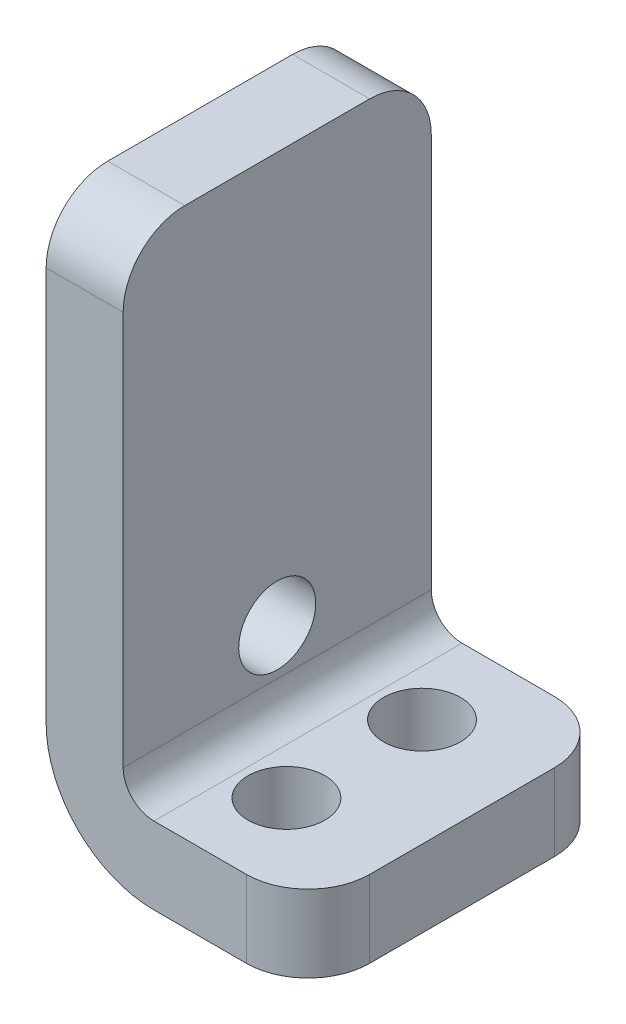
from build123d import *

# Parameters (mm, degrees)
BOSS_EXTRUDE1_DEPTH = 12.7
FILLET1_R           = 2.54
CUT_EXTRUDE2_REACH  = 26.94
SKETCH3_R           = 1.5875
CUT_EXTRUDE3_REACH  = 37.068
SKETCH5_R           = 1.5875


with BuildPart() as part:
    # Sketch1 → Boss-Extrude1 (new body)
    with BuildSketch(Plane.XY):
        with BuildLine():
            Line((0, 31.786786623), (0, 12.990786623))
            ThreePointArc((0, 12.990786623), (0.371974388, 12.092761011), (1.27, 11.720786623))
            Line((1.27, 11.720786623), (7.62, 11.720786623))
            Line((7.62, 11.720786623), (7.62, 8.545786623))
            Line((7.62, 8.545786623), (1.27, 8.545786623))
            ThreePointArc((1.27, 8.545786623), (-1.873089642, 9.847696981), (-3.175, 12.990786623))
            Line((-3.175, 12.990786623), (-3.175, 31.786786623))
            Line((-3.175, 31.786786623), (0, 31.786786623))
        make_face()
    extrude(amount=BOSS_EXTRUDE1_DEPTH)

    # Fillet1
    fillet1_edges = [part.edges().sort_by_distance(p)[0] for p in [
        (7.62, 10.133286623, 12.7),
        (7.62, 10.133286623, 0),
        (-1.5875, 31.786786623, 12.7),
        (-1.5875, 31.786786623, 0),
    ]]
    fillet(fillet1_edges, radius=FILLET1_R)

    # Sketch3 → Cut-Extrude2 (cut, up to next)
    with BuildSketch(Plane(origin=(0, 11.720786623, 0), x_dir=(1, 0, 0), z_dir=(0, 1, 0)), mode=Mode.PRIVATE) as cut_extrude2_sk1:
        with Locations((3.175, -9.144)):
            Circle(SKETCH3_R)
    cut_extrude2_tool1 = extrude(cut_extrude2_sk1.sketch, amount=-CUT_EXTRUDE2_REACH, mode=Mode.PRIVATE) & part.part
    # Sketch3 → Cut-Extrude2 (cut, up to next)
    with BuildSketch(Plane(origin=(0, 11.720786623, 0), x_dir=(1, 0, 0), z_dir=(0, 1, 0)), mode=Mode.PRIVATE) as cut_extrude2_sk2:
        with Locations((3.175, -3.556)):
            Circle(SKETCH3_R)
    cut_extrude2_tool2 = extrude(cut_extrude2_sk2.sketch, amount=-CUT_EXTRUDE2_REACH, mode=Mode.PRIVATE) & part.part
    add(cut_extrude2_tool1.solids().sort_by_distance((3.175, 11.720787, 9.144))[0], mode=Mode.SUBTRACT)
    add(cut_extrude2_tool2.solids().sort_by_distance((3.175, 11.720787, 3.556))[0], mode=Mode.SUBTRACT)

    # Sketch5 → Cut-Extrude3 (cut, up to next)
    with BuildSketch(Plane(origin=(0, 0, 0), x_dir=(0, 0, -1), z_dir=(1, 0, 0)), mode=Mode.PRIVATE) as cut_extrude3_sk1:
        with Locations((-6.35, 14.895786623)):
            Circle(SKETCH5_R)
    cut_extrude3_tool1 = extrude(cut_extrude3_sk1.sketch, amount=-CUT_EXTRUDE3_REACH, mode=Mode.PRIVATE) & part.part
    add(cut_extrude3_tool1.solids().sort_by_distance((0, 14.895787, 6.35))[0], mode=Mode.SUBTRACT)


solid = part.part
